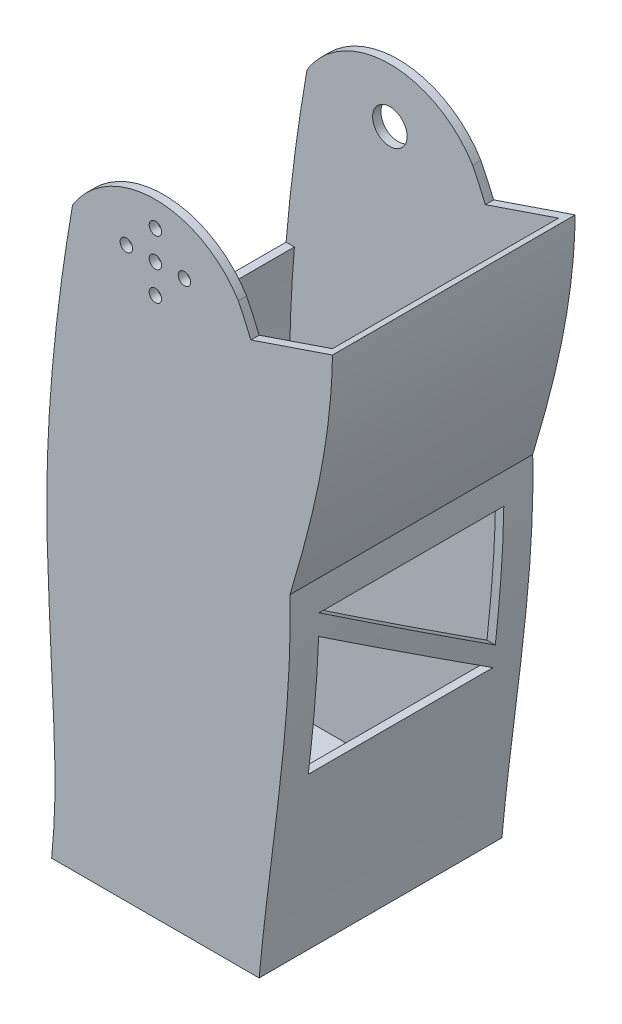
from build123d import *

# Parameters (mm, degrees)
BOSS_EXTRUDE2_DEPTH    = 29.25
SHELL1_START           = -27.25
SHELL1_DEPTH           = 54.5
SKETCH5_R              = 1.5
CUT_EXTRUDE1_DEPTH     = 10
SKETCH7_R              = 4.15
CUT_EXTRUDE2_DEPTH     = 10
CUT_EXTRUDE3_START     = -25.005806005
CUT_EXTRUDE3_OUTLINE_W = 54.5
CUT_EXTRUDE3_OUTLINE_H = 42.03
CUT_EXTRUDE3_DEPTH     = 7.686761041
CUT_EXTRUDE4_DEPTH     = 50


# Read off the part's stored shape, not the designer's step: Shell1, Cut-Extrude3
with BuildPart() as part:
    # Sketch1 → Boss-Extrude2 (new, symmetric)
    with BuildSketch(Plane.XY):
        with BuildLine():
            add(Edge.make_bspline(
                [(19.962487454, 138.853288168), (41.917427828, 94.54048465), (29.191219647, 46.138081633), (25, 0)],
                knots=[0, 0, 0, 0, 1, 1, 1, 1], degree=3))
            Line((25, 0), (-25, 0))
            add(Edge.make_bspline(
                [(-25, 0), (-23.298057286, 17.650439214), (-24.828805493, 28.118661159), (-26.675673302, 82.464844647), (-24.630274172, 112.160668427), (-19.962487454, 138.853288168)],
                knots=[0, 0, 0, 0, 0.642794877, 0.742794877, 1, 1, 1, 1], degree=3))
            ThreePointArc((-19.962487454, 138.853288168), (0, 150), (19.962487454, 138.853288168))
        make_face()
        with BuildLine():
            add(Edge.make_bspline(
                [(23.007844524, 132.160083246), (29.56348807, 116.391897373), (32.074297101, 100.154587849), (32.436411355, 83.726937617)],
                knots=[0.050122329, 0.050122329, 0.050122329, 0.050122329, 0.402824499, 0.402824499, 0.402824499, 0.402824499], degree=3))
            add(Edge.make_bspline(
                [(32.436411355, 83.726937617), (37.787413803, 101.649397291), (42.405639106, 120.029165776), (42.669837829, 138.853288168)],
                knots=[0, 0, 0, 0, 1, 1, 1, 1], degree=3))
            Line((42.669837829, 138.853288168), (23.007844524, 132.160083246))
        make_face()
    extrude(amount=BOSS_EXTRUDE2_DEPTH, both=True)

    # Shell1 outline → Shell1 (cut)
    with BuildSketch(Plane.XY.offset(SHELL1_START)):
        with BuildLine():
            add(Edge.make_bspline(
                [(-22.726512201, 3.000000268), (-22.515400895, 5.628558039), (-22.353797485, 8.143017414), (-22.23855878, 10.575207517), (-22.16652512, 12.956595464), (-22.134495082, 15.318292661), (-22.139086554, 17.691222393), (-22.176749624, 20.106574567), (-22.243898938, 22.596222108), (-22.337039728, 25.192796842), (-22.452799228, 27.929396359), (-22.587870103, 30.839192942), (-22.738951507, 33.95531695), (-22.90276284, 37.31106559), (-23.123010793, 41.923312914), (-23.170684862, 42.927154174), (-23.218988845, 43.95170376), (-23.267857496, 44.997621614), (-23.317225539, 46.065567216), (-23.36702767, 47.156199568), (-23.417198556, 48.270177213), (-23.467672835, 49.408158216), (-23.518385116, 50.570800183), (-23.569269979, 51.758760241), (-23.620261977, 52.972695057), (-23.671295631, 54.213260825), (-23.722305436, 55.481113271), (-23.776408384, 56.857894801), (-23.779590561, 56.938991098), (-23.782772373, 57.020196704), (-23.785953804, 57.101511778), (-23.789134836, 57.182936478), (-23.792315457, 57.264470971), (-23.795495646, 57.346115406), (-23.798675392, 57.427869955), (-23.801854675, 57.509734767), (-23.805033482, 57.59171001), (-23.808211794, 57.673795839), (-23.811389598, 57.755992417), (-23.814566876, 57.838299903), (-23.820920349, 58.003137009), (-23.82409662, 58.085666131), (-23.827271967, 58.168305598), (-23.830447208, 58.251062408), (-23.833622177, 58.333930429), (-23.83679611, 58.416900452), (-23.839968439, 58.499970689), (-23.843139051, 58.583147031), (-23.846307976, 58.66643551), (-23.849474956, 58.749835212), (-23.852639404, 58.833339749), (-23.855800903, 58.916947953), (-23.858959655, 59.000670832), (-23.868425891, 59.252162102), (-23.874723619, 59.420260025), (-23.881006002, 59.588798108), (-23.887270791, 59.757779436), (-23.893515736, 59.92720709), (-23.89973859, 60.09708416), (-23.905937103, 60.267413722), (-23.912109026, 60.43819887), (-23.91825211, 60.609442678), (-23.924364106, 60.781148239), (-23.930442766, 60.953318631), (-23.936485841, 61.125956941), (-23.942491081, 61.299066253), (-23.960386552, 61.819816445), (-23.972156519, 62.168879698), (-23.983748201, 62.519864003), (-23.995143657, 62.872793951), (-24.006324946, 63.227694136), (-24.017274128, 63.584589147), (-24.027973263, 63.94350358), (-24.038404411, 64.304462024), (-24.048549632, 64.667489073), (-24.058390984, 65.032609319), (-24.067910528, 65.399847355), (-24.077090324, 65.769227771), (-24.085912432, 66.140775162), (-24.102805388, 66.888253074), (-24.110876253, 67.264183442), (-24.118553575, 67.64232974), (-24.125819421, 68.022716466), (-24.132655855, 68.405368105), (-24.139044934, 68.790309112), (-24.144968717, 69.177563942), (-24.150409251, 69.56715701), (-24.155348588, 69.959112736), (-24.159768767, 70.353455499), (-24.16365183, 70.750209677), (-24.166979812, 71.14939962), (-24.169734744, 71.551049664), (-24.17298061, 72.157251355), (-24.173914779, 72.359938866), (-24.174698994, 72.563251907), (-24.175330976, 72.767192589), (-24.175808429, 72.971762716), (-24.1761291, 73.176965049), (-24.176290757, 73.38280331), (-24.176291199, 73.589281633), (-24.176128189, 73.796403603), (-24.175799467, 74.004171699), (-24.175302719, 74.21258726), (-24.174635637, 74.421651714), (-24.173796004, 74.631369335), (-24.171767732, 75.052134888), (-24.170579364, 75.263182671), (-24.169215619, 75.474895447), (-24.167675348, 75.687273201), (-24.16595741, 75.90031593), (-24.164060653, 76.114023604), (-24.161983937, 76.328396233), (-24.159726109, 76.54343378), (-24.15728603, 76.759136255), (-24.154662549, 76.975503628), (-24.151854523, 77.192535898), (-24.148860804, 77.410233045), (-24.145680246, 77.62859506), (-24.115363366, 79.59983689), (-24.076383995, 81.394602461), (-24.024786825, 83.23191239), (-23.959985069, 85.111760468), (-23.881391923, 87.034140531), (-23.78842056, 88.999046459), (-23.680484133, 91.006472182), (-23.556995781, 93.056411669), (-23.417368614, 95.148858938), (-23.261015731, 97.283808052), (-23.087350206, 99.461253119), (-22.895785095, 101.681188291), (-22.685733433, 103.943607768), (-22.342045638, 107.400954803), (-22.222714669, 108.564023427), (-22.098541948, 109.737710936), (-21.969454089, 110.922016602), (-21.835377712, 112.116939695), (-21.696239433, 113.322479492), (-21.551965869, 114.538635259), (-21.402483637, 115.765406276), (-21.247719355, 117.002791806), (-21.087599639, 118.25079113), (-20.922051106, 119.509403514), (-20.751000374, 120.778628234), (-20.574374061, 122.05846456), (-20.300961142, 123.994135368), (-20.208411258, 124.64201169), (-20.114439956, 125.292540642), (-20.01903806, 125.945722132), (-19.922196396, 126.601556068), (-19.823905791, 127.26004236), (-19.724157069, 127.921180916), (-19.622941056, 128.584971645), (-19.520248579, 129.251414457), (-19.416070462, 129.920509259), (-19.310397531, 130.592255961), (-19.203220611, 131.266654471), (-19.094530529, 131.943704698), (-18.929211901, 132.963257479), (-18.873725107, 133.303771312), (-18.817856581, 133.64494804), (-18.761605178, 133.986787652), (-18.704969749, 134.329290135), (-18.647949149, 134.672455481), (-18.590542229, 135.016283674), (-18.532747844, 135.360774707), (-18.474564845, 135.705928564), (-18.415992088, 136.051745238), (-18.357028424, 136.398224714), (-18.297672706, 136.745366983), (-18.237923789, 137.093172032), (-18.170262616, 137.485198328), (-18.162738546, 137.528767162), (-18.155208312, 137.572346348), (-18.147671913, 137.615935899), (-18.140129343, 137.659535787), (-18.132580606, 137.70314606), (-18.125025692, 137.746766652), (-18.117464608, 137.790397639), (-18.109897342, 137.834038946), (-18.102323899, 137.877690635), (-18.094744273, 137.921352663), (-18.087158463, 137.965025055), (-18.079566467, 138.008707799), (-18.06816919, 138.07424745), (-18.064368551, 138.096096589), (-18.060566364, 138.117948316), (-18.05676263, 138.139802636), (-18.052957347, 138.161659537), (-18.049150517, 138.183519038), (-18.045342136, 138.205381114), (-18.04153221, 138.227245794), (-18.037720731, 138.249113049), (-18.033907705, 138.270982903), (-18.030093129, 138.29285534), (-18.026277002, 138.314730368), (-18.022459326, 138.336607985), (-18.017685292, 138.363958241), (-18.016730389, 138.369428455), (-18.015775388, 138.374898829), (-18.014820291, 138.380369369), (-18.013865096, 138.385840061), (-18.012909806, 138.39131093), (-18.011954416, 138.396781942), (-18.010998932, 138.402253136), (-18.010043349, 138.407724474), (-18.009087671, 138.413195987), (-18.008131894, 138.418667653), (-18.007176022, 138.424139486), (-18.006220052, 138.429611478), (-18.004785951, 138.437819711), (-18.004307894, 138.440555828), (-18.003829812, 138.443291987), (-18.003351706, 138.446028185), (-18.002873575, 138.448764426), (-18.002395421, 138.451500703), (-18.001917242, 138.454237026), (-18.001439039, 138.456973384), (-18.000960811, 138.459709787), (-18.00048256, 138.462446227), (-18.000004284, 138.46518271), (-17.999525984, 138.467919232), (-17.999047659, 138.470655794), (-17.998090962, 138.476129001), (-17.997611806, 138.478870117), (-17.997140049, 138.481568909), (-17.996633564, 138.484465751), (-17.996231615, 138.486766156), (-17.995606001, 138.49034209), (-17.995334694, 138.491897848), (-17.994641163, 138.495859712), (-17.994323195, 138.497682754), (-17.99376549, 138.500869085), (-17.993304577, 138.503506721), (-17.992831534, 138.5062113), (-17.992348735, 138.508972223), (-17.989945795, 138.522713372), (-17.988023444, 138.533706292), (-17.986101092, 138.544699209), (-17.984178741, 138.555692132), (-17.982256388, 138.566685044), (-17.980334038, 138.577677974), (-17.978411685, 138.588670881), (-17.976489334, 138.599663812), (-17.974566982, 138.610656721), (-17.972644631, 138.621649647), (-17.970722279, 138.632642563), (-17.968799927, 138.643635483), (-17.966877575, 138.654628402), (-17.94957641, 138.753564675), (-17.934197597, 138.841508027), (-17.918818784, 138.929451382), (-17.90343997, 139.017394731), (-17.888061158, 139.105338092), (-17.872682343, 139.193281434), (-17.857303531, 139.2812248), (-17.841924717, 139.369168141), (-17.826545904, 139.457111504), (-17.81116709, 139.545054851), (-17.795788277, 139.632998207), (-17.780409464, 139.72094156), (-17.765030651, 139.808884913), (-17.718894211, 140.072714973), (-17.688136584, 140.248601679), (-17.657378957, 140.424488386), (-17.62662133, 140.60037509), (-17.595863704, 140.776261802), (-17.565106077, 140.9521485), (-17.534348451, 141.128035217), (-17.503590823, 141.303921913), (-17.472833198, 141.479808628), (-17.44207557, 141.655695328), (-17.411317944, 141.831582038), (-17.380560317, 142.007468743), (-17.349802691, 142.18335545), (-17.319045064, 142.359242157)],
                knots=[0.039453504, 0.039453504, 0.039453504, 0.039453504, 0.039453504, 0.039453504, 0.039453504, 0.039453504, 0.039453504, 0.039453504, 0.039453504, 0.039453504, 0.039453504, 0.039453504, 0.039453504, 0.506183735, 0.506183735, 0.506183735, 0.506183735, 0.506183735, 0.506183735, 0.506183735, 0.506183735, 0.506183735, 0.506183735, 0.506183735, 0.506183735, 0.506183735, 0.632729669, 0.632729669, 0.632729669, 0.632729669, 0.632729669, 0.632729669, 0.632729669, 0.632729669, 0.632729669, 0.632729669, 0.632729669, 0.632729669, 0.632729669, 0.640638789, 0.640638789, 0.640638789, 0.640638789, 0.640638789, 0.640638789, 0.640638789, 0.640638789, 0.640638789, 0.640638789, 0.640638789, 0.640638789, 0.640638789, 0.64854791, 0.64854791, 0.64854791, 0.64854791, 0.64854791, 0.64854791, 0.64854791, 0.64854791, 0.64854791, 0.64854791, 0.64854791, 0.64854791, 0.64854791, 0.664366152, 0.664366152, 0.664366152, 0.664366152, 0.664366152, 0.664366152, 0.664366152, 0.664366152, 0.664366152, 0.664366152, 0.664366152, 0.664366152, 0.664366152, 0.696002636, 0.696002636, 0.696002636, 0.696002636, 0.696002636, 0.696002636, 0.696002636, 0.696002636, 0.696002636, 0.696002636, 0.696002636, 0.696002636, 0.696002636, 0.727639119, 0.727639119, 0.727639119, 0.727639119, 0.727639119, 0.727639119, 0.727639119, 0.727639119, 0.727639119, 0.727639119, 0.727639119, 0.727639119, 0.727639119, 0.743457361, 0.743457361, 0.743457361, 0.743457361, 0.743457361, 0.743457361, 0.743457361, 0.743457361, 0.743457361, 0.743457361, 0.743457361, 0.743457361, 0.743457361, 0.759275602, 0.759275602, 0.759275602, 0.759275602, 0.759275602, 0.759275602, 0.759275602, 0.759275602, 0.759275602, 0.759275602, 0.759275602, 0.759275602, 0.759275602, 0.885821536, 0.885821536, 0.885821536, 0.885821536, 0.885821536, 0.885821536, 0.885821536, 0.885821536, 0.885821536, 0.885821536, 0.885821536, 0.885821536, 0.885821536, 0.949094503, 0.949094503, 0.949094503, 0.949094503, 0.949094503, 0.949094503, 0.949094503, 0.949094503, 0.949094503, 0.949094503, 0.949094503, 0.949094503, 0.949094503, 0.980730986, 0.980730986, 0.980730986, 0.980730986, 0.980730986, 0.980730986, 0.980730986, 0.980730986, 0.980730986, 0.980730986, 0.980730986, 0.980730986, 0.980730986, 0.996549228, 0.996549228, 0.996549228, 0.996549228, 0.996549228, 0.996549228, 0.996549228, 0.996549228, 0.996549228, 0.996549228, 0.996549228, 0.996549228, 0.996549228, 0.998526508, 0.998526508, 0.998526508, 0.998526508, 0.998526508, 0.998526508, 0.998526508, 0.998526508, 0.998526508, 0.998526508, 0.998526508, 0.998526508, 0.998526508, 0.999515148, 0.999515148, 0.999515148, 0.999515148, 0.999515148, 0.999515148, 0.999515148, 0.999515148, 0.999515148, 0.999515148, 0.999515148, 0.999515148, 0.999515148, 0.999762308, 0.999762308, 0.999762308, 0.999762308, 0.999762308, 0.999762308, 0.999762308, 0.999762308, 0.999762308, 0.999762308, 0.999762308, 0.999762308, 0.999762308, 0.999885888, 0.999885888, 0.999885888, 0.999885888, 0.999885888, 0.999885888, 0.999885888, 0.999885888, 0.999885888, 0.999885888, 0.999885888, 0.999885888, 0.999885888, 1.000009468, 1.000009468, 1.000009468, 1.000009468, 1.000009468, 1.000009468, 1.000009468, 1.000009468, 1.000009468, 1.000009468, 1.000009468, 1.000009468, 1.000009468, 1.000503789, 1.000503789, 1.000503789, 1.000503789, 1.000503789, 1.000503789, 1.000503789, 1.000503789, 1.000503789, 1.000503789, 1.000503789, 1.000503789, 1.000503789, 1.004458349, 1.004458349, 1.004458349, 1.004458349, 1.004458349, 1.004458349, 1.004458349, 1.004458349, 1.004458349, 1.004458349, 1.004458349, 1.004458349, 1.004458349, 1.01236747, 1.01236747, 1.01236747, 1.01236747, 1.01236747, 1.01236747, 1.01236747, 1.01236747, 1.01236747, 1.01236747, 1.01236747, 1.01236747, 1.01236747, 1.01236747, 1.01236747], degree=14))
            Line((-22.726512201, 3.000000268), (23.2742257, 2.999999799))
            add(Edge.make_bspline(
                [(30.429713815, 83.996697281), (30.60244978, 76.719092235), (30.461014046, 69.401512454), (30.054600005, 62.051221125), (29.432696123, 54.675961984), (28.645205566, 47.283663735), (27.742390439, 39.882179066), (26.774746982, 32.479209201), (25.79299986, 25.082321187), (24.848136762, 17.698752256), (23.991354914, 10.335646682), (23.2742257, 2.999999799)],
                knots=[0.400554113, 0.400554113, 0.400554113, 0.400554113, 0.400554113, 0.400554113, 0.400554113, 0.400554113, 0.400554113, 0.400554113, 0.400554113, 0.400554113, 0.979751532, 0.979751532, 0.979751532, 0.979751532, 0.979751532, 0.979751532, 0.979751532, 0.979751532, 0.979751532, 0.979751532, 0.979751532, 0.979751532], degree=11))
            add(Edge.make_bspline(
                [(30.429713815, 83.996697281), (30.435983649, 84.0176966), (30.442253349, 84.038696113), (30.448523049, 84.059695626), (30.454792749, 84.080695139), (30.46106245, 84.101694652), (30.46733215, 84.122694165), (30.47360185, 84.143693679), (30.47987155, 84.164693192), (30.489659813, 84.197477656), (30.493178375, 84.209262606), (30.496696938, 84.221047557), (30.500215501, 84.232832508), (30.503734064, 84.244617458), (30.507252627, 84.256402409), (30.510771189, 84.26818736), (30.514289752, 84.279972311), (30.518248135, 84.29323038), (30.518687564, 84.294702194), (30.51913046, 84.29618558), (30.519559553, 84.297622848), (30.520019891, 84.299164591), (30.520439185, 84.300569001), (30.520885728, 84.302064655), (30.521322661, 84.303528142), (30.522199482, 84.306465039), (30.522637888, 84.307933489), (30.523076291, 84.309401941), (30.523514689, 84.310870394), (30.523953084, 84.312338849), (30.524391475, 84.313807306), (30.524829862, 84.315275765), (30.525268245, 84.316744225), (30.526583383, 84.321149612), (30.527460126, 84.324086543), (30.528336853, 84.327023481), (30.529213565, 84.329960426), (30.530090261, 84.332897377), (30.530966942, 84.335834336), (30.531843607, 84.338771302), (30.532720256, 84.341708274), (30.535350158, 84.350519212), (30.537103364, 84.356393198), (30.538856507, 84.362267212), (30.540609588, 84.368141253), (30.542362607, 84.374015321), (30.544115563, 84.379889418), (30.545868457, 84.385763541), (30.547621288, 84.391637693), (30.556385131, 84.421008587), (30.563395205, 84.444505742), (30.570404274, 84.468003338), (30.577412338, 84.491501374), (30.584419392, 84.514999851), (30.591425435, 84.538498768), (30.598430464, 84.561998125), (30.605434475, 84.585497923), (30.640449437, 84.702999113), (30.668445096, 84.797007109), (30.696424275, 84.891022148), (30.724386808, 84.98504423), (30.752332525, 85.079073353), (30.78026126, 85.173109517), (30.808172844, 85.267152719), (30.83606711, 85.361202959), (30.919697447, 85.643374789), (30.975381059, 85.83151749), (31.030993382, 86.019688328), (31.086533074, 86.207887295), (31.141998792, 86.396114379), (31.197389195, 86.584369571), (31.252702941, 86.772652862), (31.307938686, 86.960964241), (31.473407896, 87.525982614), (31.583403324, 87.902773851), (31.693070651, 88.279677319), (31.802399156, 88.656692926), (31.911378118, 89.033820582), (32.019996816, 89.411060194), (32.128244527, 89.788411674), (32.23611053, 90.165874928), (32.558531252, 91.298599744), (32.771908507, 92.054196433), (32.983630382, 92.810239044), (33.193611391, 93.566726686), (33.401766046, 94.323658468), (33.608008861, 95.0810335), (33.812254349, 95.83885089), (34.014417024, 96.59710975), (34.614400149, 98.873208061), (35.005716745, 100.392369168), (35.387678757, 101.91328422), (35.75960505, 103.435945021), (36.120815781, 104.960343466), (36.470632399, 106.486471543), (36.808377647, 108.014321328), (37.133375562, 109.543884993), (38.052261358, 114.059837701), (38.608580446, 117.051003706), (39.108909026, 120.048600742), (39.548274064, 123.052584337), (39.9217249, 126.062926555), (40.224328945, 129.079624948), (40.451167377, 132.102711499), (40.597330844, 135.132261566), (40.657915154, 138.168402829)],
                knots=[-0.005624436, -0.005624436, -0.005624436, -0.005624436, -0.005624436, -0.005624436, -0.005624436, -0.005624436, -0.005624436, -0.005624436, -0.002109375, -0.002109375, -0.002109375, -0.002109375, -0.002109375, -0.002109375, -0.002109375, -0.002109375, -0.000136719, -0.000136719, -0.000136719, -0.000136719, -0.000136719, -0.000136719, -0.000136719, -0.000136719, 0.000109863, 0.000109863, 0.000109863, 0.000109863, 0.000109863, 0.000109863, 0.000109863, 0.000109863, 0.000356445, 0.000356445, 0.000356445, 0.000356445, 0.000356445, 0.000356445, 0.000356445, 0.000356445, 0.000849609, 0.000849609, 0.000849609, 0.000849609, 0.000849609, 0.000849609, 0.000849609, 0.000849609, 0.001835937, 0.001835937, 0.001835937, 0.001835937, 0.001835937, 0.001835937, 0.001835937, 0.001835937, 0.00578125, 0.00578125, 0.00578125, 0.00578125, 0.00578125, 0.00578125, 0.00578125, 0.00578125, 0.0215625, 0.0215625, 0.0215625, 0.0215625, 0.0215625, 0.0215625, 0.0215625, 0.0215625, 0.053125, 0.053125, 0.053125, 0.053125, 0.053125, 0.053125, 0.053125, 0.053125, 0.11625, 0.11625, 0.11625, 0.11625, 0.11625, 0.11625, 0.11625, 0.11625, 0.2425, 0.2425, 0.2425, 0.2425, 0.2425, 0.2425, 0.2425, 0.2425, 0.495, 0.495, 0.495, 0.495, 0.495, 0.495, 0.495, 0.495, 0.987161754, 0.987161754, 0.987161754, 0.987161754, 0.987161754, 0.987161754, 0.987161754, 0.987161754, 0.987161754, 0.987161754], degree=9))
            Line((40.657915154, 138.168402829), (23.007844524, 132.160083246))
            add(Edge.make_bspline(
                [(19.962487454, 138.853288168), (21.062920197, 136.632227253), (22.076225299, 134.400892252), (23.007844524, 132.160083246)],
                knots=[0, 0, 0, 0, 0.050122329, 0.050122329, 0.050122329, 0.050122329], degree=3))
            ThreePointArc((19.962487454, 138.853288168), (2.195421431, 149.896998546), (-17.319045064, 142.359242157))
        make_face()
    extrude(amount=SHELL1_DEPTH, mode=Mode.SUBTRACT)

    # Sketch5 → Cut-Extrude1 (cut)
    with BuildSketch(Plane.XY.offset(29.25)):
        with Locations((0, 143.956400622)):
            Circle(SKETCH5_R)
        with Locations((7, 136.956400622)):
            Circle(SKETCH5_R)
        with Locations((0, 129.956400622)):
            Circle(SKETCH5_R)
        with Locations((-7, 136.956400622)):
            Circle(SKETCH5_R)
        with Locations((0, 136.956400622)):
            Circle(SKETCH5_R)
    extrude(amount=-CUT_EXTRUDE1_DEPTH, mode=Mode.SUBTRACT)

    # Sketch7 → Cut-Extrude2 (cut)
    with BuildSketch(Plane(origin=(0, 0, -29.25), x_dir=(-1, 0, 0), z_dir=(0, 0, -1))):
        with Locations((0, 136.956400622)):
            Circle(SKETCH7_R)
    extrude(amount=-CUT_EXTRUDE2_DEPTH, mode=Mode.SUBTRACT)

    # Cut-Extrude3 outline → Cut-Extrude3 (cut)
    with BuildSketch(Plane(origin=(0, 0, 0), x_dir=(0, 0, -1), z_dir=(1, 0, 0)).offset(CUT_EXTRUDE3_START)):
        with Locations((0, 121.344242157)):
            Rectangle(CUT_EXTRUDE3_OUTLINE_W, CUT_EXTRUDE3_OUTLINE_H)
    extrude(amount=CUT_EXTRUDE3_DEPTH, mode=Mode.SUBTRACT)

    # Sketch9 → Cut-Extrude4 (cut, symmetric)
    with BuildSketch(Plane(origin=(0, 0, 0), x_dir=(0, 0, -1), z_dir=(1, 0, 0))):
        Polygon((-22.25, 76.449537865), (22.25, 76.449537865), (22.25, 46.449537865), align=None)
        Polygon((22.25, 41.449537865), (-22.25, 71.449537865), (-22.25, 41.449537865), align=None)
    extrude(amount=CUT_EXTRUDE4_DEPTH, both=True, mode=Mode.SUBTRACT)


solid = part.part
